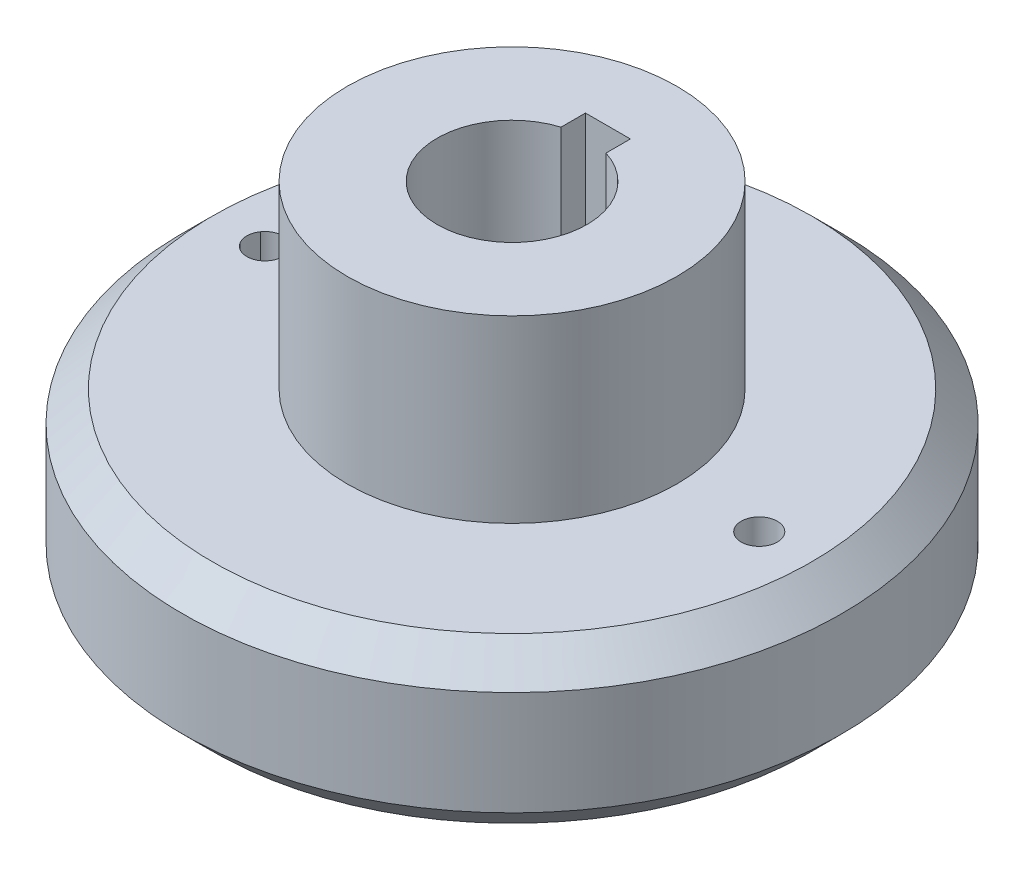
from build123d import *

# Parameters (mm, degrees)
SKETCH_2_W          = 3
SKETCH_2_H          = 54.842712326
CUT_EXTRUDE_1_DEPTH = 6.4
SKETCH_4_R          = 1.20395169
SKETCH_4_R_2        = 1.206806351
CUT_EXTRUDE_2_DEPTH = 34.346795948


with BuildPart() as part:
    # Эскиз1 → Revolve 1 (revolve)
    with BuildSketch(Plane.XY):
        Polygon((5, 23), (5, 0), (17.5, 0), (17.5, 11), (11, 11), (11, 23), align=None)
    revolve(axis=Axis((0, 0, 0), (0, 1, 0)))

    # Эскиз2 → Вырез-Вытянуть1 (cut)
    with BuildSketch(Plane.XY):
        Rectangle(SKETCH_2_W, SKETCH_2_H)
    extrude(amount=-CUT_EXTRUDE_1_DEPTH, mode=Mode.SUBTRACT)

    # Эскиз3 → Revolve 1 2 (revolve)
    with BuildSketch(Plane.XY):
        Polygon((17.4999, 0), (17.4999, 11), (20.000041421, 11), (22.0001, 8.999941421), (22.0001, 2.04399768), (19.95610232, 0), align=None)
        Polygon((17.5, 0.0001), (17.5, 10.9999), (20, 10.9999), (22, 8.9999), (22, 2.044039102), (19.956060898, 0.0001), align=None, mode=Mode.SUBTRACT)
    revolve(axis=Axis((0, 0, 0), (0, 1, 0)))

    # Эскиз4 → Вырез-Вытянуть2 (cut, through all)
    with BuildSketch(Plane(origin=(0, 11, 0), x_dir=(1, 0, 0), z_dir=(0, 1, 0))):
        with Locations((-16.5, 0)):
            Circle(SKETCH_4_R)
        with Locations((16.5, 0)):
            Circle(SKETCH_4_R_2)
    extrude(amount=-CUT_EXTRUDE_2_DEPTH, mode=Mode.SUBTRACT)


solid = part.part
